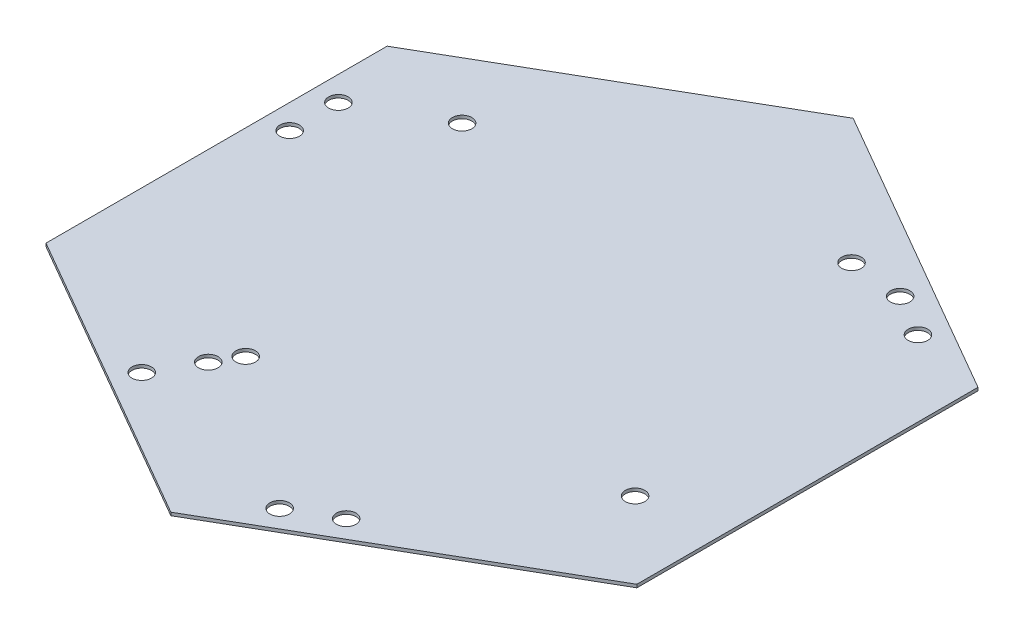
from build123d import *

# Parameters (mm, degrees)
SKETCH1_R           = 2.54
BOSS_EXTRUDE1_DEPTH = 0.8128
SKETCH2_R           = 2.54
CUT_EXTRUDE1_DEPTH  = 118.606454516
SKETCH3_R           = 2.54
CUT_EXTRUDE2_DEPTH  = 118.606454516


with BuildPart() as part:
    # Sketch1 → Boss-Extrude1 (new body)
    with BuildSketch(Plane(origin=(0, 0, 0), x_dir=(1, 0, 0), z_dir=(0, 1, 0))):
        Polygon((0, 88.9), (-76.989658396, 44.45), (-76.989658396, -44.45), (0, -88.9), (76.989658396, -44.45), (76.989658396, 44.45), align=None)
        with Locations((13.322783942, -73.875738686)):
            Circle(SKETCH1_R, mode=Mode.SUBTRACT)
        with Locations((24.32130657, -67.525738686)):
            Circle(SKETCH1_R, mode=Mode.SUBTRACT)
        with Locations((-70.639658396, 12.7)):
            Circle(SKETCH1_R, mode=Mode.SUBTRACT)
        with Locations((-70.639658396, 25.4)):
            Circle(SKETCH1_R, mode=Mode.SUBTRACT)
        with Locations((46.318351826, 54.825738686)):
            Circle(SKETCH1_R, mode=Mode.SUBTRACT)
        with Locations((57.316874454, 48.475738686)):
            Circle(SKETCH1_R, mode=Mode.SUBTRACT)
    extrude(amount=BOSS_EXTRUDE1_DEPTH)

    # Sketch2 → Cut-Extrude1 (cut, through all)
    with BuildSketch(Plane(origin=(0, 0.8128, 0), x_dir=(1, 0, 0), z_dir=(0, 1, 0))):
        with Locations((-49.850334746, 36.846687445)):
            Circle(SKETCH2_R)
        with Locations((-25.4, -43.994090512)):
            Circle(SKETCH2_R)
        with Locations((32.385, 56.092465403)):
            Circle(SKETCH2_R)
        with Locations((56.835334746, -24.748312555)):
            Circle(SKETCH2_R)
    extrude(amount=-CUT_EXTRUDE1_DEPTH, mode=Mode.SUBTRACT)

    # Sketch3 → Cut-Extrude2 (cut, through all)
    with BuildSketch(Plane(origin=(0, 0.8128, 0), x_dir=(1, 0, 0), z_dir=(0, 1, 0))):
        with Locations((-35.319829198, -61.175738686)):
            Circle(SKETCH3_R)
        with Locations((-28.969829198, -50.177216058)):
            Circle(SKETCH3_R)
    extrude(amount=-CUT_EXTRUDE2_DEPTH, mode=Mode.SUBTRACT)


solid = part.part
